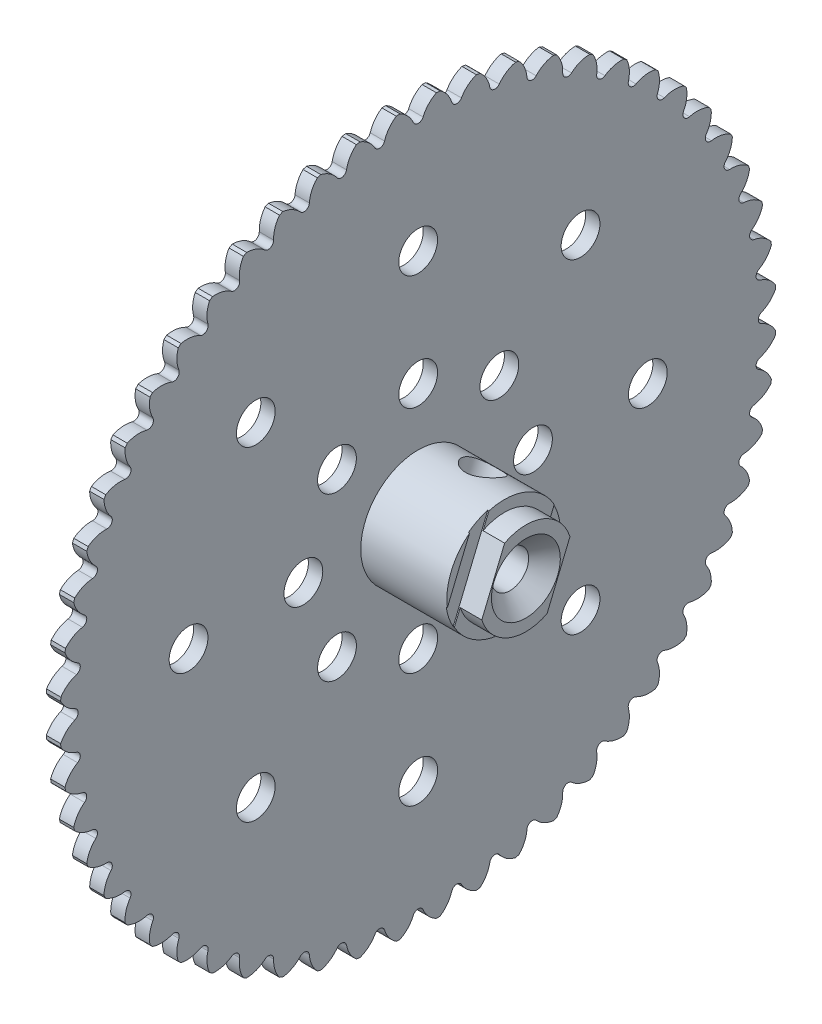
from build123d import *

# Parameters (mm, degrees)
SKETCH1_R           = 39.5986
BOSS_EXTRUDE1_DEPTH = 1.5875
SKETCH2_R           = 2.1463
CUT_EXTRUDE1_DEPTH  = 1.5875
CIRPATTERN1_COUNT   = 8
CUT_EXTRUDE2_START  = -1.5875
CUT_EXTRUDE2_DEPTH  = 1.5875
CIRPATTERN2_COUNT   = 56
SKETCH7_R           = 6.35
BOSS_EXTRUDE3_DEPTH = 9.525
BOSS_EXTRUDE4_DEPTH = 2.3876
SKETCH9_R           = 2.0574
CUT_EXTRUDE3_DEPTH  = 58.534434255
CUT_EXTRUDE4_START  = -0.127
CUT_EXTRUDE4_DEPTH  = 0.127
SKETCH12_W          = 1.984375
SKETCH12_H          = 12.7


with BuildPart() as part:
    # Sketch1 → Boss-Extrude1 (new body)
    with BuildSketch(Plane(origin=(0, 0, 0), x_dir=(0, 0, -1), z_dir=(1, 0, 0))):
        Circle(SKETCH1_R)
    extrude(amount=BOSS_EXTRUDE1_DEPTH)

    # Sketch2 → Cut-Extrude1 (cut)
    with BuildSketch(Plane(origin=(1.5875, 0, 0), x_dir=(0, 0, -1), z_dir=(1, 0, 0))):
        with Locations((0, 12.7)):
            Circle(SKETCH2_R)
        with Locations((0, 25.4)):
            Circle(SKETCH2_R)
    cut_extrude1 = extrude(amount=-CUT_EXTRUDE1_DEPTH, mode=Mode.SUBTRACT)

    # CirPattern1: Cut-Extrude1 ×8 about axis
    cirpattern1_axis = Axis((1.5875, 0, 0), (1, 0, 0))
    for i in range(1, CIRPATTERN1_COUNT):
        add(cut_extrude1.rotate(cirpattern1_axis, i * 360 / CIRPATTERN1_COUNT), mode=Mode.SUBTRACT)

    # Sketch4 → Cut-Extrude2 (cut)
    with BuildSketch(Plane(origin=(1.5875, 0, 0), x_dir=(0, 0, -1), z_dir=(1, 0, 0)).offset(CUT_EXTRUDE2_START)):
        with BuildLine():
            ThreePointArc((2.01740165, 39.547177049), (0, 39.5986), (-2.01740165, 39.547177049))
            ThreePointArc((-2.01740165, 39.547177049), (-1.138604793, 38.888877086), (-0.536592031, 37.970605125))
            ThreePointArc((-0.536592031, 37.970605125), (0, 37.6174), (0.536592031, 37.970605125))
            ThreePointArc((0.536592031, 37.970605125), (1.138604793, 38.888877086), (2.01740165, 39.547177049))
        make_face()
    cut_extrude2 = extrude(amount=CUT_EXTRUDE2_DEPTH, mode=Mode.SUBTRACT)

    # CirPattern2: Cut-Extrude2 ×56 about axis
    cirpattern2_axis = Axis((1.5875, 0, 0), (1, 0, 0))
    for i in range(1, CIRPATTERN2_COUNT):
        add(cut_extrude2.rotate(cirpattern2_axis, i * 360 / CIRPATTERN2_COUNT), mode=Mode.SUBTRACT)

    # Sketch7 → Boss-Extrude3 (add)
    with BuildSketch(Plane(origin=(1.5875, 0, 0), x_dir=(0, 0, -1), z_dir=(1, 0, 0))):
        Circle(SKETCH7_R)
    extrude(amount=BOSS_EXTRUDE3_DEPTH)

    # Sketch8 → Boss-Extrude4 (add)
    with BuildSketch(Plane(origin=(11.1125, 0, 0), x_dir=(0, 0, -1), z_dir=(1, 0, 0))):
        with BuildLine():
            Line((-4.876953722, -1.552504431), (-2.350740637, 4.546313459))
            ThreePointArc((-2.350740637, 4.546313459), (1.958612075, 4.728507835), (4.876953722, 1.552504431))
            Line((4.876953722, 1.552504431), (2.350740637, -4.546313459))
            ThreePointArc((2.350740637, -4.546313459), (-1.958612075, -4.728507835), (-4.876953722, -1.552504431))
        make_face()
    extrude(amount=BOSS_EXTRUDE4_DEPTH)

    # Sketch9 → Cut-Extrude3 (cut, through all)
    with BuildSketch(Plane(origin=(13.5001, 0, 0), x_dir=(0, 0, -1), z_dir=(1, 0, 0))):
        Circle(SKETCH9_R)
    extrude(amount=-CUT_EXTRUDE3_DEPTH, mode=Mode.SUBTRACT)

    # Sketch10 → Cut-Extrude4 (cut)
    with BuildSketch(Plane(origin=(11.1125, 0, 0), x_dir=(0, 0, -1), z_dir=(1, 0, 0)).offset(CUT_EXTRUDE4_START)):
        with BuildLine():
            Line((-5.528101678, -3.124514657), (-1.699592681, 6.118323685))
            ThreePointArc((-1.699592681, 6.118323685), (-2.823102406, 5.687933966), (-3.845267539, 5.053357058))
            Line((-3.845267539, 5.053357058), (-6.292277796, -0.854248291))
            ThreePointArc((-6.292277796, -0.854248291), (-6.018211534, -2.025741823), (-5.528101678, -3.124514657))
        make_face()
        with BuildLine():
            Line((3.845267539, -5.053357058), (6.292277796, 0.854248291))
            ThreePointArc((6.292277796, 0.854248291), (6.018211534, 2.025741823), (5.528101678, 3.124514657))
            Line((5.528101678, 3.124514657), (1.699592681, -6.118323685))
            ThreePointArc((1.699592681, -6.118323685), (2.823102406, -5.687933966), (3.845267539, -5.053357058))
        make_face()
    extrude(amount=CUT_EXTRUDE4_DEPTH, mode=Mode.SUBTRACT)

    # Sketch11 → Cut-Revolve4 (revolve, cut)
    with BuildSketch(Plane.XY):
        Polygon((9.6901, 0), (13.5001, 0), (13.5001, 3.81), align=None)
    revolve(axis=Axis((13.5001, 0, 0), (-1, 0, 0)), mode=Mode.SUBTRACT)

    # Sketch12 → Cut-Revolve5 (revolve, cut)
    with BuildSketch(Plane(origin=(0, 0, 0), x_dir=(-1, 0, 0), z_dir=(0, -0.3826834323650839, -0.9238795325112892))):
        with Locations((-7.3421875, 0)):
            Rectangle(SKETCH12_W, SKETCH12_H)
    revolve(axis=Axis((6.35, -5.866635031, 2.430039796), (0, 0.9238795325112892, -0.3826834323650839)), mode=Mode.SUBTRACT)


solid = part.part
